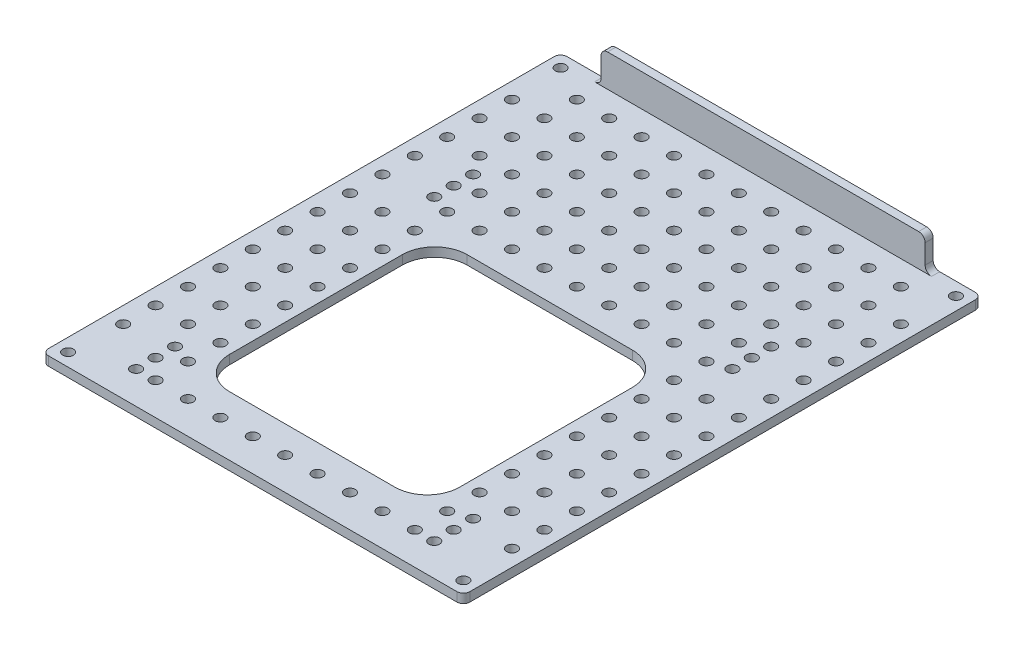
from build123d import *

# Parameters (mm, degrees)
SKETCH_1_W          = 130
SKETCH_1_H          = 160
EXTRUDE_1_DEPTH     = 2.8
SKETCH_2_R          = 1.65
CUT_EXTRUDE_1_DEPTH = 3
SKETCH_3_R          = 1.65
CUT_EXTRUDE_2_DEPTH = 3
SKETCH_4_R          = 1.65
CUT_EXTRUDE_3_DEPTH = 3
SKETCH_5_W          = 100
SKETCH_5_H          = 2.5
EXTRUDE_2_DEPTH     = 10
SKETCH_6_W          = 71
SKETCH_6_H          = 73.3
CUT_EXTRUDE_4_DEPTH = 10
FILLET_1_R          = 10
FILLET_2_R          = 2


with BuildPart() as part:
    # 草图1 → 凸台-拉伸1 (new body)
    with BuildSketch(Plane(origin=(0, 0, 0), x_dir=(1, 0, 0), z_dir=(0, 1, 0))):
        Rectangle(SKETCH_1_W, SKETCH_1_H)
    extrude(amount=EXTRUDE_1_DEPTH)

    # 草图2 → 切除-拉伸1 (cut)
    with BuildSketch(Plane(origin=(0, 2.8, 0), x_dir=(1, 0, 0), z_dir=(0, 1, 0))):
        with Locations((-61, 76)):
            Circle(SKETCH_2_R)
        with Locations((61, 76)):
            Circle(SKETCH_2_R)
        with Locations((61, -76)):
            Circle(SKETCH_2_R)
        with Locations((-61, -76)):
            Circle(SKETCH_2_R)
    extrude(amount=-CUT_EXTRUDE_1_DEPTH, mode=Mode.SUBTRACT)

    # 草图3 → 切除-拉伸2 (cut)
    with BuildSketch(Plane(origin=(0, 2.8, 0), x_dir=(1, 0, 0), z_dir=(0, 1, 0))):
        with Locations((-46, 22)):
            Circle(SKETCH_3_R)
        with Locations((46, 22)):
            Circle(SKETCH_3_R)
        with Locations((46, -70)):
            Circle(SKETCH_3_R)
        with Locations((-46, -70)):
            Circle(SKETCH_3_R)
        with Locations((-46, 28)):
            Circle(SKETCH_3_R)
        with Locations((46, 28)):
            Circle(SKETCH_3_R)
        with Locations((-46, -64)):
            Circle(SKETCH_3_R)
        with Locations((46, -64)):
            Circle(SKETCH_3_R)
        with Locations((-46, 34)):
            Circle(SKETCH_3_R)
        with Locations((46, 34)):
            Circle(SKETCH_3_R)
        with Locations((-46, -58)):
            Circle(SKETCH_3_R)
        with Locations((46, -58)):
            Circle(SKETCH_3_R)
    extrude(amount=-CUT_EXTRUDE_2_DEPTH, mode=Mode.SUBTRACT)

    # 草图4 → 切除-拉伸3 (cut)
    with BuildSketch(Plane(origin=(0, 2.8, 0), x_dir=(1, 0, 0), z_dir=(0, 1, 0))):
        with Locations((0, 70)):
            Circle(SKETCH_4_R)
        with Locations((10, 70)):
            Circle(SKETCH_4_R)
        with Locations((20, 70)):
            Circle(SKETCH_4_R)
        with Locations((30, 70)):
            Circle(SKETCH_4_R)
        with Locations((40, 70)):
            Circle(SKETCH_4_R)
        with Locations((50, 70)):
            Circle(SKETCH_4_R)
        with Locations((-10, 70)):
            Circle(SKETCH_4_R)
        with Locations((-20, 70)):
            Circle(SKETCH_4_R)
        with Locations((-30, 70)):
            Circle(SKETCH_4_R)
        with Locations((-40, 70)):
            Circle(SKETCH_4_R)
        with Locations((-50, 70)):
            Circle(SKETCH_4_R)
        with Locations((0, 60)):
            Circle(SKETCH_4_R)
        with Locations((10, 60)):
            Circle(SKETCH_4_R)
        with Locations((20, 60)):
            Circle(SKETCH_4_R)
        with Locations((30, 60)):
            Circle(SKETCH_4_R)
        with Locations((40, 60)):
            Circle(SKETCH_4_R)
        with Locations((50, 60)):
            Circle(SKETCH_4_R)
        with Locations((-10, 60)):
            Circle(SKETCH_4_R)
        with Locations((-20, 60)):
            Circle(SKETCH_4_R)
        with Locations((-30, 60)):
            Circle(SKETCH_4_R)
        with Locations((-40, 60)):
            Circle(SKETCH_4_R)
        with Locations((-50, 60)):
            Circle(SKETCH_4_R)
        with Locations((0, 50)):
            Circle(SKETCH_4_R)
        with Locations((10, 50)):
            Circle(SKETCH_4_R)
        with Locations((20, 50)):
            Circle(SKETCH_4_R)
        with Locations((30, 50)):
            Circle(SKETCH_4_R)
        with Locations((40, 50)):
            Circle(SKETCH_4_R)
        with Locations((50, 50)):
            Circle(SKETCH_4_R)
        with Locations((-10, 50)):
            Circle(SKETCH_4_R)
        with Locations((-20, 50)):
            Circle(SKETCH_4_R)
        with Locations((-30, 50)):
            Circle(SKETCH_4_R)
        with Locations((-40, 50)):
            Circle(SKETCH_4_R)
        with Locations((-50, 50)):
            Circle(SKETCH_4_R)
        with Locations((0, 40)):
            Circle(SKETCH_4_R)
        with Locations((10, 40)):
            Circle(SKETCH_4_R)
        with Locations((20, 40)):
            Circle(SKETCH_4_R)
        with Locations((30, 40)):
            Circle(SKETCH_4_R)
        with Locations((40, 40)):
            Circle(SKETCH_4_R)
        with Locations((50, 40)):
            Circle(SKETCH_4_R)
        with Locations((-10, 40)):
            Circle(SKETCH_4_R)
        with Locations((-20, 40)):
            Circle(SKETCH_4_R)
        with Locations((-30, 40)):
            Circle(SKETCH_4_R)
        with Locations((-40, 40)):
            Circle(SKETCH_4_R)
        with Locations((-50, 40)):
            Circle(SKETCH_4_R)
        with Locations((0, 30)):
            Circle(SKETCH_4_R)
        with Locations((10, 30)):
            Circle(SKETCH_4_R)
        with Locations((20, 30)):
            Circle(SKETCH_4_R)
        with Locations((30, 30)):
            Circle(SKETCH_4_R)
        with Locations((40, 30)):
            Circle(SKETCH_4_R)
        with Locations((-10, 30)):
            Circle(SKETCH_4_R)
        with Locations((-20, 30)):
            Circle(SKETCH_4_R)
        with Locations((-30, 30)):
            Circle(SKETCH_4_R)
        with Locations((-40, 30)):
            Circle(SKETCH_4_R)
        with Locations((0, 20)):
            Circle(SKETCH_4_R)
        with Locations((10, 20)):
            Circle(SKETCH_4_R)
        with Locations((20, 20)):
            Circle(SKETCH_4_R)
        with Locations((30, 20)):
            Circle(SKETCH_4_R)
        with Locations((40, 20)):
            Circle(SKETCH_4_R)
        with Locations((-10, 20)):
            Circle(SKETCH_4_R)
        with Locations((-20, 20)):
            Circle(SKETCH_4_R)
        with Locations((-30, 20)):
            Circle(SKETCH_4_R)
        with Locations((-40, 20)):
            Circle(SKETCH_4_R)
        with Locations((0, 10)):
            Circle(SKETCH_4_R)
        with Locations((10, 10)):
            Circle(SKETCH_4_R)
        with Locations((20, 10)):
            Circle(SKETCH_4_R)
        with Locations((30, 10)):
            Circle(SKETCH_4_R)
        with Locations((40, 10)):
            Circle(SKETCH_4_R)
        with Locations((50, 10)):
            Circle(SKETCH_4_R)
        with Locations((-10, 10)):
            Circle(SKETCH_4_R)
        with Locations((-20, 10)):
            Circle(SKETCH_4_R)
        with Locations((-30, 10)):
            Circle(SKETCH_4_R)
        with Locations((-40, 10)):
            Circle(SKETCH_4_R)
        with Locations((-50, 10)):
            Circle(SKETCH_4_R)
        Circle(SKETCH_4_R)
        with Locations((10, 0)):
            Circle(SKETCH_4_R)
        with Locations((20, 0)):
            Circle(SKETCH_4_R)
        with Locations((30, 0)):
            Circle(SKETCH_4_R)
        with Locations((40, 0)):
            Circle(SKETCH_4_R)
        with Locations((50, 0)):
            Circle(SKETCH_4_R)
        with Locations((-10, 0)):
            Circle(SKETCH_4_R)
        with Locations((-20, 0)):
            Circle(SKETCH_4_R)
        with Locations((-30, 0)):
            Circle(SKETCH_4_R)
        with Locations((-40, 0)):
            Circle(SKETCH_4_R)
        with Locations((-50, 0)):
            Circle(SKETCH_4_R)
        with Locations((0, -10)):
            Circle(SKETCH_4_R)
        with Locations((10, -10)):
            Circle(SKETCH_4_R)
        with Locations((20, -10)):
            Circle(SKETCH_4_R)
        with Locations((30, -10)):
            Circle(SKETCH_4_R)
        with Locations((40, -10)):
            Circle(SKETCH_4_R)
        with Locations((50, -10)):
            Circle(SKETCH_4_R)
        with Locations((-10, -10)):
            Circle(SKETCH_4_R)
        with Locations((-20, -10)):
            Circle(SKETCH_4_R)
        with Locations((-30, -10)):
            Circle(SKETCH_4_R)
        with Locations((-40, -10)):
            Circle(SKETCH_4_R)
        with Locations((-50, -10)):
            Circle(SKETCH_4_R)
        with Locations((0, -20)):
            Circle(SKETCH_4_R)
        with Locations((10, -20)):
            Circle(SKETCH_4_R)
        with Locations((20, -20)):
            Circle(SKETCH_4_R)
        with Locations((30, -20)):
            Circle(SKETCH_4_R)
        with Locations((40, -20)):
            Circle(SKETCH_4_R)
        with Locations((50, -20)):
            Circle(SKETCH_4_R)
        with Locations((-10, -20)):
            Circle(SKETCH_4_R)
        with Locations((-20, -20)):
            Circle(SKETCH_4_R)
        with Locations((-30, -20)):
            Circle(SKETCH_4_R)
        with Locations((-40, -20)):
            Circle(SKETCH_4_R)
        with Locations((-50, -20)):
            Circle(SKETCH_4_R)
        with Locations((0, -30)):
            Circle(SKETCH_4_R)
        with Locations((10, -30)):
            Circle(SKETCH_4_R)
        with Locations((20, -30)):
            Circle(SKETCH_4_R)
        with Locations((30, -30)):
            Circle(SKETCH_4_R)
        with Locations((40, -30)):
            Circle(SKETCH_4_R)
        with Locations((50, -30)):
            Circle(SKETCH_4_R)
        with Locations((-10, -30)):
            Circle(SKETCH_4_R)
        with Locations((-20, -30)):
            Circle(SKETCH_4_R)
        with Locations((-30, -30)):
            Circle(SKETCH_4_R)
        with Locations((-40, -30)):
            Circle(SKETCH_4_R)
        with Locations((-50, -30)):
            Circle(SKETCH_4_R)
        with Locations((0, -40)):
            Circle(SKETCH_4_R)
        with Locations((10, -40)):
            Circle(SKETCH_4_R)
        with Locations((20, -40)):
            Circle(SKETCH_4_R)
        with Locations((30, -40)):
            Circle(SKETCH_4_R)
        with Locations((40, -40)):
            Circle(SKETCH_4_R)
        with Locations((50, -40)):
            Circle(SKETCH_4_R)
        with Locations((-10, -40)):
            Circle(SKETCH_4_R)
        with Locations((-20, -40)):
            Circle(SKETCH_4_R)
        with Locations((-30, -40)):
            Circle(SKETCH_4_R)
        with Locations((-40, -40)):
            Circle(SKETCH_4_R)
        with Locations((-50, -40)):
            Circle(SKETCH_4_R)
        with Locations((0, -50)):
            Circle(SKETCH_4_R)
        with Locations((10, -50)):
            Circle(SKETCH_4_R)
        with Locations((20, -50)):
            Circle(SKETCH_4_R)
        with Locations((30, -50)):
            Circle(SKETCH_4_R)
        with Locations((40, -50)):
            Circle(SKETCH_4_R)
        with Locations((50, -50)):
            Circle(SKETCH_4_R)
        with Locations((-10, -50)):
            Circle(SKETCH_4_R)
        with Locations((-20, -50)):
            Circle(SKETCH_4_R)
        with Locations((-30, -50)):
            Circle(SKETCH_4_R)
        with Locations((-40, -50)):
            Circle(SKETCH_4_R)
        with Locations((-50, -50)):
            Circle(SKETCH_4_R)
        with Locations((0, -60)):
            Circle(SKETCH_4_R)
        with Locations((10, -60)):
            Circle(SKETCH_4_R)
        with Locations((20, -60)):
            Circle(SKETCH_4_R)
        with Locations((30, -60)):
            Circle(SKETCH_4_R)
        with Locations((40, -60)):
            Circle(SKETCH_4_R)
        with Locations((-10, -60)):
            Circle(SKETCH_4_R)
        with Locations((-20, -60)):
            Circle(SKETCH_4_R)
        with Locations((-30, -60)):
            Circle(SKETCH_4_R)
        with Locations((-40, -60)):
            Circle(SKETCH_4_R)
        with Locations((0, -70)):
            Circle(SKETCH_4_R)
        with Locations((10, -70)):
            Circle(SKETCH_4_R)
        with Locations((20, -70)):
            Circle(SKETCH_4_R)
        with Locations((30, -70)):
            Circle(SKETCH_4_R)
        with Locations((40, -70)):
            Circle(SKETCH_4_R)
        with Locations((-10, -70)):
            Circle(SKETCH_4_R)
        with Locations((-20, -70)):
            Circle(SKETCH_4_R)
        with Locations((-30, -70)):
            Circle(SKETCH_4_R)
        with Locations((-40, -70)):
            Circle(SKETCH_4_R)
        with Locations((-60, 60)):
            Circle(SKETCH_4_R)
        with Locations((-60, 50)):
            Circle(SKETCH_4_R)
        with Locations((-60, 40)):
            Circle(SKETCH_4_R)
        with Locations((-60, 30)):
            Circle(SKETCH_4_R)
        with Locations((-60, 20)):
            Circle(SKETCH_4_R)
        with Locations((-60, 10)):
            Circle(SKETCH_4_R)
        with Locations((-60, 0)):
            Circle(SKETCH_4_R)
        with Locations((-60, -10)):
            Circle(SKETCH_4_R)
        with Locations((-60, -20)):
            Circle(SKETCH_4_R)
        with Locations((-60, -30)):
            Circle(SKETCH_4_R)
        with Locations((-60, -40)):
            Circle(SKETCH_4_R)
        with Locations((-60, -50)):
            Circle(SKETCH_4_R)
        with Locations((-60, -60)):
            Circle(SKETCH_4_R)
        with Locations((60, -60)):
            Circle(SKETCH_4_R)
        with Locations((60, -50)):
            Circle(SKETCH_4_R)
        with Locations((60, -40)):
            Circle(SKETCH_4_R)
        with Locations((60, -30)):
            Circle(SKETCH_4_R)
        with Locations((60, -20)):
            Circle(SKETCH_4_R)
        with Locations((60, -10)):
            Circle(SKETCH_4_R)
        with Locations((60, 0)):
            Circle(SKETCH_4_R)
        with Locations((60, 10)):
            Circle(SKETCH_4_R)
        with Locations((60, 20)):
            Circle(SKETCH_4_R)
        with Locations((60, 30)):
            Circle(SKETCH_4_R)
        with Locations((60, 40)):
            Circle(SKETCH_4_R)
        with Locations((60, 50)):
            Circle(SKETCH_4_R)
        with Locations((60, 60)):
            Circle(SKETCH_4_R)
    extrude(amount=-CUT_EXTRUDE_3_DEPTH, mode=Mode.SUBTRACT)

    # 草图5 → 凸台-拉伸2 (add)
    with BuildSketch(Plane(origin=(0, 2.8, 0), x_dir=(1, 0, 0), z_dir=(0, 1, 0))):
        with Locations((0, 78.75)):
            Rectangle(SKETCH_5_W, SKETCH_5_H)
    extrude(amount=EXTRUDE_2_DEPTH)

    # 草图6 → 切除-拉伸4 (cut)
    with BuildSketch(Plane(origin=(0, 2.8, 0), x_dir=(1, 0, 0), z_dir=(0, 1, 0))):
        with Locations((0, -25)):
            Rectangle(SKETCH_6_W, SKETCH_6_H)
    extrude(amount=-CUT_EXTRUDE_4_DEPTH, mode=Mode.SUBTRACT)

    # 圆角1
    fillet_1_edges = [part.edges().sort_by_distance(p)[0] for p in [
        (-35.5, 1.4, 61.65),
        (35.5, 1.4, 61.65),
        (35.5, 1.4, -11.65),
        (-35.5, 1.4, -11.65),
    ]]
    fillet(fillet_1_edges, radius=FILLET_1_R)

    # 圆角2
    fillet_2_edges = [part.edges().sort_by_distance(p)[0] for p in [
        (65, 1.4, 80),
        (-65, 1.4, 80),
        (65, 1.4, -80),
        (-65, 1.4, -80),
        (-50, 2.8, -78.75),
        (50, 2.8, -78.75),
        (50, 12.8, -78.75),
        (-50, 12.8, -78.75),
    ]]
    fillet(fillet_2_edges, radius=FILLET_2_R)


solid = part.part
